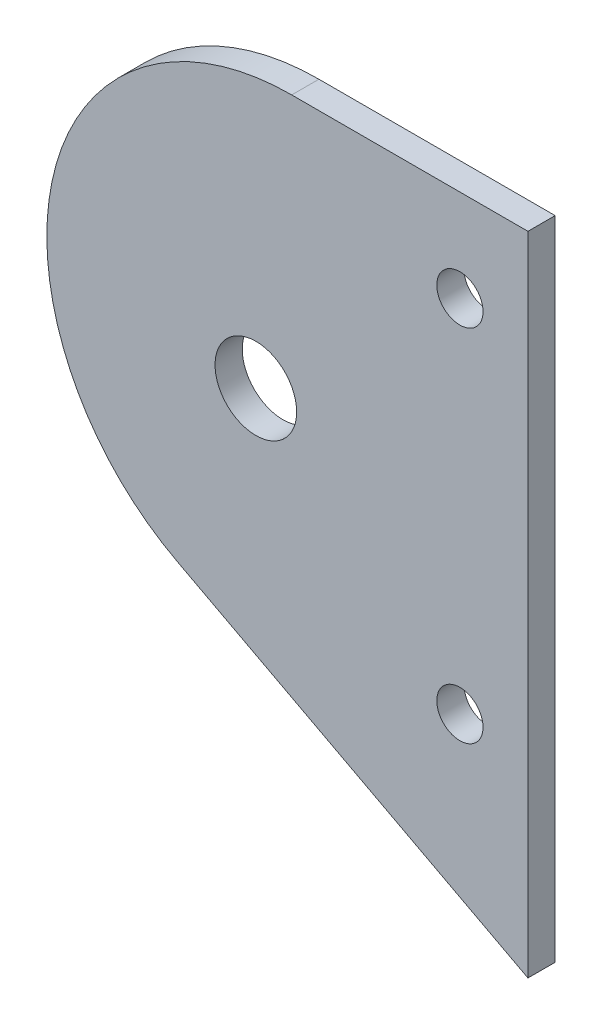
from build123d import *

# Parameters (mm, degrees)
ESQUISSE1_R                  = 3
BOSS_EXTRU_1_DEPTH           = 2
CONG_1_R                     = 18
CONG_2_R                     = 20
ENL_V_MAT_EXTRU_2_DEPTH      = 195.530962239
ENL_V_MAT_EXTRU_2_DEPTH_BACK = 10
ESQUISSE2_W                  = 356.718168982
ESQUISSE2_H                  = 96.805953854
D_GAGEMENT_M31_D             = 3.4


with BuildPart() as part:
    # Esquisse1 → Boss.-Extru.1 (new body)
    with BuildSketch(Plane.XY):
        Polygon((-244.958991582, 40), (-110, 40), (110, 40), (244.958991582, 40), (112.479495791, -30), (-112.479495791, -30), align=None)
        with Locations((-175, 20)):
            Circle(ESQUISSE1_R, mode=Mode.SUBTRACT)
        with Locations((-110, -20)):
            Circle(ESQUISSE1_R, mode=Mode.SUBTRACT)
        with Locations((110, -20)):
            Circle(ESQUISSE1_R, mode=Mode.SUBTRACT)
        with Locations((175, 20)):
            Circle(ESQUISSE1_R, mode=Mode.SUBTRACT)
        with Locations((0, -20)):
            Circle(ESQUISSE1_R, mode=Mode.SUBTRACT)
        with Locations((-58.333333333, 20)):
            Circle(ESQUISSE1_R, mode=Mode.SUBTRACT)
        with Locations((58.333333333, 20)):
            Circle(ESQUISSE1_R, mode=Mode.SUBTRACT)
    extrude(amount=BOSS_EXTRU_1_DEPTH)

    # Congé1
    cong_1_edges = [part.edges().sort_by_distance(p)[0] for p in [
        (-244.958991582, 40, 1),
        (244.958991582, 40, 1),
    ]]
    fillet(cong_1_edges, radius=CONG_1_R)

    # Congé2
    cong_2_edges = [part.edges().sort_by_distance(p)[0] for p in [
        (-112.479495791, -30, 1),
        (112.479495791, -30, 1),
    ]]
    fillet(cong_2_edges, radius=CONG_2_R)

    # Esquisse2 → Enlèv. mat.-Extru.2 (cut, two sides: drawn at the far end of the back side and taken through both)
    with BuildSketch(Plane.XY.offset(-ENL_V_MAT_EXTRU_2_DEPTH_BACK)):
        with Locations((23.359084491, 12.745190259)):
            Rectangle(ESQUISSE2_W, ESQUISSE2_H)
    extrude(amount=ENL_V_MAT_EXTRU_2_DEPTH + ENL_V_MAT_EXTRU_2_DEPTH_BACK, mode=Mode.SUBTRACT)

    # Dégagement M31 (through all)
    with Locations(Plane(origin=(0, 0, 0), x_dir=(-1, 0, 0), z_dir=(0, 0, -1))):
        with Locations((160, 33.228756555), (160, 6.771243445)):
            Hole(D_GAGEMENT_M31_D / 2)


solid = part.part
